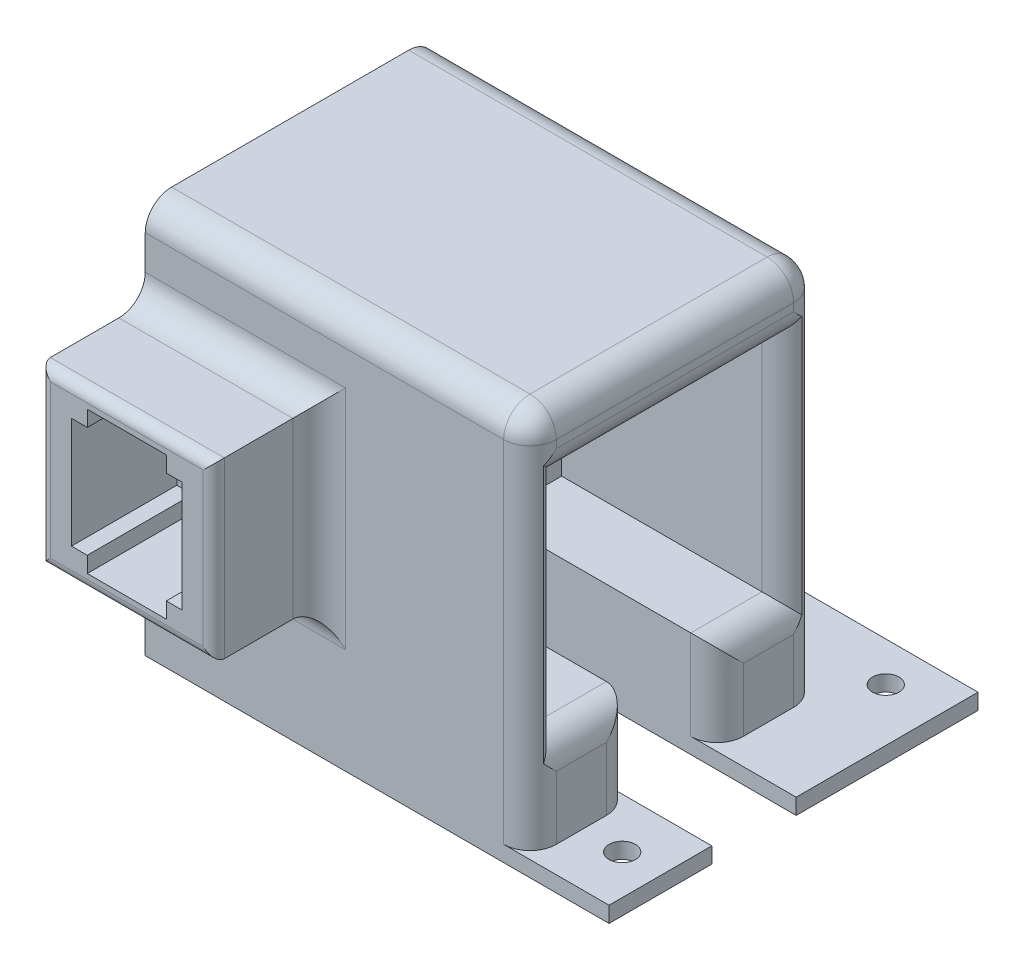
from build123d import *

# Parameters (mm, degrees)
SKETCH1_W           = 33
SKETCH1_H           = 33
BOSS_EXTRUDE1_DEPTH = 20
SHELL1_T            = -6
SKETCH2_W           = 73
SKETCH2_H           = 71.5
BOSS_EXTRUDE2_DEPTH = 55
SKETCH7_W           = 15
SKETCH7_H           = 50
CUT_EXTRUDE2_DEPTH  = 3
SKETCH9_W           = 21
SKETCH9_H           = 21
CUT_EXTRUDE5_DEPTH  = 45
SKETCH16_W          = 55
SKETCH16_H          = 55
BOSS_EXTRUDE5_DEPTH = 40
CUT_EXTRUDE14_REACH = 105.943
BOSS_EXTRUDE6_START = -26
SKETCH23_W          = 3
SKETCH23_H          = 3
BOSS_EXTRUDE6_DEPTH = 6
BOSS_EXTRUDE7_REACH = 148.943
BOSS_EXTRUDE7_START = -43
SKETCH24_W          = 13.5
SKETCH24_H          = 5
SKETCH25_R          = 2.5
BOSS_EXTRUDE8_DEPTH = 3
FILLET1_R           = 5
FILLET2_R           = 2


with BuildPart() as part:
    # Sketch1 → Boss-Extrude1 (new body)
    with BuildSketch(Plane.XY):
        with Locations((16.5, 16.5)):
            Rectangle(SKETCH1_W, SKETCH1_H)
    extrude(amount=BOSS_EXTRUDE1_DEPTH)

    # Shell1
    shell1_openings = [part.faces().sort_by_distance(p)[0] for p in [
        (16.5, 16.5, 20),
    ]]
    offset(amount=SHELL1_T, openings=shell1_openings, kind=Kind.INTERSECTION)

    # Sketch2 → Boss-Extrude2 (add)
    with BuildSketch(Plane(origin=(0, 0, 0), x_dir=(-1, 0, 0), z_dir=(0, 0, -1))):
        with Locations((-36.5, 13.75)):
            Rectangle(SKETCH2_W, SKETCH2_H)
    extrude(amount=BOSS_EXTRUDE2_DEPTH)

    # Sketch7 → Cut-Extrude2 (cut)
    with BuildSketch(Plane.XZ.offset(-27)):
        with Locations((16.5, -5)):
            Rectangle(SKETCH7_W, SKETCH7_H)
    cut_extrude2 = extrude(amount=-CUT_EXTRUDE2_DEPTH, mode=Mode.SUBTRACT)

    # Sketch9 → Cut-Extrude5 (cut)
    with BuildSketch(Plane.XY.offset(6)):
        with Locations((16.5, 16.5)):
            Rectangle(SKETCH9_W, SKETCH9_H)
    extrude(amount=-CUT_EXTRUDE5_DEPTH, mode=Mode.SUBTRACT)

    # Mirror2: Cut-Extrude2 across plane
    add(cut_extrude2.mirror(Plane(origin=(0, 16.5, 0), x_dir=(0, 0, 1), z_dir=(0, -1, 0))), mode=Mode.SUBTRACT)

    # Sketch16 → Boss-Extrude5 (add)
    with BuildSketch(Plane(origin=(33, 0, 0), x_dir=(0, 0, -1), z_dir=(1, 0, 0))):
        with Locations((27.5, 16.5)):
            Rectangle(SKETCH16_W, SKETCH16_H)
    extrude(amount=BOSS_EXTRUDE5_DEPTH)

    # Cut-Extrude14: up to this face of the body (flat: up to its plane)
    cut_extrude14_end = Plane(part.part.faces().sort_by_distance((6, 16.5, -9.5))[0])
    # Sketch22 → Cut-Extrude14 (cut, up to the picked face)
    with BuildSketch(Plane(origin=(73, 0, 0), x_dir=(0, 0, -1), z_dir=(1, 0, 0)), mode=Mode.PRIVATE) as cut_extrude14_sk1:
        Polygon((6, -5), (19.5, -5), (19.5, -22), (35.5, -22), (35.5, -5), (49, -5), (49, 38), (6, 38), align=None)
    cut_extrude14_tool1 = split(extrude(cut_extrude14_sk1.sketch, amount=-CUT_EXTRUDE14_REACH, mode=Mode.PRIVATE), bisect_by=cut_extrude14_end, keep=Keep.BOTH, mode=Mode.PRIVATE)
    add(cut_extrude14_tool1.solids().sort_by(Axis((73, 12.652758, -27.5), (-1, 0, 0)))[0], mode=Mode.SUBTRACT)

    # Sketch23 → Boss-Extrude6 (add)
    with BuildSketch(Plane.XY.offset(20).offset(BOSS_EXTRUDE6_START)):
        with Locations((7.5, 7.5)):
            Rectangle(SKETCH23_W, SKETCH23_H)
        with Locations((7.5, 25.5)):
            Rectangle(SKETCH23_W, SKETCH23_H)
        with Locations((25.5, 25.5)):
            Rectangle(SKETCH23_W, SKETCH23_H)
        with Locations((25.5, 7.5)):
            Rectangle(SKETCH23_W, SKETCH23_H)
    extrude(amount=BOSS_EXTRUDE6_DEPTH)

    # Sketch24 → Boss-Extrude7 (add, up to next)
    with BuildSketch(Plane(origin=(73, 0, 0), x_dir=(0, 0, -1), z_dir=(1, 0, 0)).offset(BOSS_EXTRUDE7_START), mode=Mode.PRIVATE) as boss_extrude7_sk1:
        with Locations((12.75, -2.5)):
            Rectangle(SKETCH24_W, SKETCH24_H)
    boss_extrude7_tool1 = extrude(boss_extrude7_sk1.sketch, amount=-BOSS_EXTRUDE7_REACH, mode=Mode.PRIVATE) - part.part
    # Sketch24 → Boss-Extrude7 (add, up to next)
    with BuildSketch(Plane(origin=(73, 0, 0), x_dir=(0, 0, -1), z_dir=(1, 0, 0)).offset(BOSS_EXTRUDE7_START), mode=Mode.PRIVATE) as boss_extrude7_sk2:
        with Locations((42.25, -2.5)):
            Rectangle(SKETCH24_W, SKETCH24_H)
    boss_extrude7_tool2 = extrude(boss_extrude7_sk2.sketch, amount=-BOSS_EXTRUDE7_REACH, mode=Mode.PRIVATE) - part.part
    add(boss_extrude7_tool1.solids().sort_by_distance((30, -2.5, -12.75))[0])
    add(boss_extrude7_tool2.solids().sort_by_distance((30, -2.5, -42.25))[0])

    # Sketch25 → Boss-Extrude8 (add)
    with BuildSketch(Plane.XZ.offset(22)):
        Polygon((0, 0), (88, 0), (88, -19.5), (30, -19.5), (30, -35.5), (88, -35.5), (88, -70), (0, -70), align=None)
        with Locations(Location((10, -62.5, 0), (0, 0, 270))):
            Circle(SKETCH25_R, mode=Mode.SUBTRACT)
        with Locations(Location((78, -62.5, 0), (0, 0, 270))):
            Circle(SKETCH25_R, mode=Mode.SUBTRACT)
        with Locations(Location((80.5, -10, 0), (0, 0, 270))):
            Circle(SKETCH25_R, mode=Mode.SUBTRACT)
    extrude(amount=BOSS_EXTRUDE8_DEPTH)

    # Fillet1
    # the kernel refuses this fillet: 5 mm, written as the material it adds along each edge
    with BuildSketch(Plane(origin=(33, 33, 0), x_dir=(0, 0, 1), z_dir=(-1, 0, 0)), Plane(origin=(33, 0, 0), x_dir=(0, 0, 1), z_dir=(0, 1, 0)), Plane(origin=(0, 0, 0), x_dir=(0, 0, 1), z_dir=(1, 0, 0))) as fillet1_piece_1:
        with BuildLine():
            CenterArc((FILLET1_R, FILLET1_R), FILLET1_R, 180, 90)
            Line((0, FILLET1_R), (-FILLET1_R * 0.02, FILLET1_R))
            Line((-FILLET1_R * 0.02, FILLET1_R), (-FILLET1_R * 0.02, -FILLET1_R * 0.02))
            Line((-FILLET1_R * 0.02, -FILLET1_R * 0.02), (FILLET1_R, -FILLET1_R * 0.02))
            Line((FILLET1_R, -FILLET1_R * 0.02), (FILLET1_R, 0))
        make_face()
    extrude(amount=33)
    with BuildSketch(Plane(origin=(33, 0, 0), x_dir=(0, 0, 1), z_dir=(0, 1, 0))) as fillet1_piece_2a_section:
        with BuildLine():
            CenterArc((FILLET1_R, FILLET1_R), FILLET1_R, 180, 90)
            Line((0, FILLET1_R), (-FILLET1_R * 0.02, FILLET1_R))
            Line((-FILLET1_R * 0.02, FILLET1_R), (-FILLET1_R * 0.02, -FILLET1_R * 0.02))
            Line((-FILLET1_R * 0.02, -FILLET1_R * 0.02), (FILLET1_R, -FILLET1_R * 0.02))
            Line((FILLET1_R, -FILLET1_R * 0.02), (FILLET1_R, 0))
        make_face()
    fillet1_piece_2a = extrude(amount=45.5, mode=Mode.PRIVATE)
    fillet1_piece_2a = split(fillet1_piece_2a, bisect_by=Plane(origin=(34.131975571, 33, 1.131975571), z_dir=(0, 1, 0)), keep=Keep.TOP, mode=Mode.PRIVATE)
    with BuildSketch(Plane(origin=(45.5, 33, 0), x_dir=(0, 0, 1), z_dir=(-1, 0, 0))) as fillet1_piece_2b_section:
        with BuildLine():
            CenterArc((FILLET1_R, FILLET1_R), FILLET1_R, 180, 90)
            Line((0, FILLET1_R), (-FILLET1_R * 0.02, FILLET1_R))
            Line((-FILLET1_R * 0.02, FILLET1_R), (-FILLET1_R * 0.02, -FILLET1_R * 0.02))
            Line((-FILLET1_R * 0.02, -FILLET1_R * 0.02), (FILLET1_R, -FILLET1_R * 0.02))
            Line((FILLET1_R, -FILLET1_R * 0.02), (FILLET1_R, 0))
        make_face()
    fillet1_piece_2b = extrude(amount=45.5, mode=Mode.PRIVATE)
    fillet1_piece_2b = split(fillet1_piece_2b, bisect_by=Plane(origin=(33, 34.131975571, 1.131975571), z_dir=(1, 0, 0)), keep=Keep.TOP, mode=Mode.PRIVATE)
    fillet1_piece_2 = fillet1_piece_2a & fillet1_piece_2b
    add(fillet1_piece_2)
    with BuildSketch(Plane(origin=(0, 0, 0), x_dir=(0, 0, 1), z_dir=(1, 0, 0))) as fillet1_piece_3a_section:
        with BuildLine():
            CenterArc((FILLET1_R, FILLET1_R), FILLET1_R, 180, 90)
            Line((0, FILLET1_R), (-FILLET1_R * 0.02, FILLET1_R))
            Line((-FILLET1_R * 0.02, FILLET1_R), (-FILLET1_R * 0.02, -FILLET1_R * 0.02))
            Line((-FILLET1_R * 0.02, -FILLET1_R * 0.02), (FILLET1_R, -FILLET1_R * 0.02))
            Line((FILLET1_R, -FILLET1_R * 0.02), (FILLET1_R, 0))
        make_face()
    fillet1_piece_3a = extrude(amount=45.5, mode=Mode.PRIVATE)
    fillet1_piece_3a = split(fillet1_piece_3a, bisect_by=Plane(origin=(33, -1.131975571, 1.131975571), z_dir=(1, 0, 0)), keep=Keep.TOP, mode=Mode.PRIVATE)
    with BuildSketch(Plane(origin=(33, -12.5, 0), x_dir=(0, 0, 1), z_dir=(0, 1, 0))) as fillet1_piece_3b_section:
        with BuildLine():
            CenterArc((FILLET1_R, FILLET1_R), FILLET1_R, 180, 90)
            Line((0, FILLET1_R), (-FILLET1_R * 0.02, FILLET1_R))
            Line((-FILLET1_R * 0.02, FILLET1_R), (-FILLET1_R * 0.02, -FILLET1_R * 0.02))
            Line((-FILLET1_R * 0.02, -FILLET1_R * 0.02), (FILLET1_R, -FILLET1_R * 0.02))
            Line((FILLET1_R, -FILLET1_R * 0.02), (FILLET1_R, 0))
        make_face()
    fillet1_piece_3b = extrude(amount=45.5, mode=Mode.PRIVATE)
    fillet1_piece_3b = split(fillet1_piece_3b, bisect_by=Plane(origin=(34.131975571, 0, 1.131975571), z_dir=(0, -1, 0)), keep=Keep.TOP, mode=Mode.PRIVATE)
    fillet1_piece_3 = fillet1_piece_3a & fillet1_piece_3b
    add(fillet1_piece_3)
    # the kernel refuses this fillet: 5 mm, written as the material it takes off along each edge
    with BuildSketch(Plane(origin=(68, 44.5, -50), x_dir=(0, 1, 0), z_dir=(1, 0, 0))) as fillet1_2_piece_1_section:
        Polygon((0, 0), (FILLET1_R * 1.02, 0), (FILLET1_R * 1.02, -FILLET1_R * 1.02), (0, -FILLET1_R * 1.02), align=None)
    fillet1_2_piece_1 = extrude(amount=FILLET1_R * 1.02, mode=Mode.PRIVATE)
    fillet1_2_piece_1 = fillet1_2_piece_1 - Plane(origin=(68, 44.5, -50), x_dir=(0, -0.7071067811865475, 0.7071067811865475), z_dir=(1, 0, 0)) * Sphere(FILLET1_R, mode=Mode.PRIVATE)
    add(fillet1_2_piece_1, mode=Mode.SUBTRACT)
    with BuildSketch(Plane(origin=(68, 44.5, -5), x_dir=(0, 1, 0), z_dir=(1, 0, 0))) as fillet1_2_piece_2_section:
        Polygon((0, 0), (FILLET1_R * 1.02, 0), (FILLET1_R * 1.02, FILLET1_R * 1.02), (0, FILLET1_R * 1.02), align=None)
    fillet1_2_piece_2 = extrude(amount=FILLET1_R * 1.02, mode=Mode.PRIVATE)
    fillet1_2_piece_2 = fillet1_2_piece_2 - Plane(origin=(68, 44.5, -5), x_dir=(0, -0.7071067811865475, -0.7071067811865475), z_dir=(1, 0, 0)) * Sphere(FILLET1_R, mode=Mode.PRIVATE)
    add(fillet1_2_piece_2, mode=Mode.SUBTRACT)
    with BuildSketch(Plane(origin=(73, -5, -49), x_dir=(0, 0, -1), z_dir=(0, 1, 0)), Plane(origin=(73, 38, -49), x_dir=(0, 1, 0), z_dir=(0, 0, 1)), Plane(origin=(73, 38, -6), x_dir=(0, 0, 1), z_dir=(0, -1, 0))) as fillet1_2_piece_3:
        with BuildLine():
            CenterArc((FILLET1_R, FILLET1_R), FILLET1_R, 180, 90)
            Line((0, FILLET1_R), (-FILLET1_R * 0.02, FILLET1_R))
            Line((-FILLET1_R * 0.02, FILLET1_R), (-FILLET1_R * 0.02, -FILLET1_R * 0.02))
            Line((-FILLET1_R * 0.02, -FILLET1_R * 0.02), (FILLET1_R, -FILLET1_R * 0.02))
            Line((FILLET1_R, -FILLET1_R * 0.02), (FILLET1_R, 0))
        make_face()
    extrude(amount=43, mode=Mode.SUBTRACT)
    with BuildSketch(Plane(origin=(73, -5, -6), x_dir=(0, -1, 0), z_dir=(0, 0, -1)), Plane(origin=(73, -5, -35.5), x_dir=(0, -1, 0), z_dir=(0, 0, -1))) as fillet1_2_piece_4:
        with BuildLine():
            CenterArc((FILLET1_R, FILLET1_R), FILLET1_R, 180, 90)
            Line((0, FILLET1_R), (-FILLET1_R * 0.02, FILLET1_R))
            Line((-FILLET1_R * 0.02, FILLET1_R), (-FILLET1_R * 0.02, -FILLET1_R * 0.02))
            Line((-FILLET1_R * 0.02, -FILLET1_R * 0.02), (FILLET1_R, -FILLET1_R * 0.02))
            Line((FILLET1_R, -FILLET1_R * 0.02), (FILLET1_R, 0))
        make_face()
    extrude(amount=13.5, mode=Mode.SUBTRACT)
    with BuildSketch(Plane(origin=(73, -5, -19.5), x_dir=(0, 0, 1), z_dir=(0, -1, 0)), Plane(origin=(73, -22, -35.5), x_dir=(0, 0, -1), z_dir=(0, 1, 0))) as fillet1_2_piece_5:
        with BuildLine():
            CenterArc((FILLET1_R, FILLET1_R), FILLET1_R, 180, 90)
            Line((0, FILLET1_R), (-FILLET1_R * 0.02, FILLET1_R))
            Line((-FILLET1_R * 0.02, FILLET1_R), (-FILLET1_R * 0.02, -FILLET1_R * 0.02))
            Line((-FILLET1_R * 0.02, -FILLET1_R * 0.02), (FILLET1_R, -FILLET1_R * 0.02))
            Line((FILLET1_R, -FILLET1_R * 0.02), (FILLET1_R, 0))
        make_face()
    extrude(amount=17, mode=Mode.SUBTRACT)
    with BuildSketch(Plane(origin=(0, 49.5, -55), x_dir=(0, 0, 1), z_dir=(1, 0, 0))) as fillet1_2_piece_6:
        with BuildLine():
            CenterArc((FILLET1_R, FILLET1_R), FILLET1_R, 180, 90)
            Line((0, FILLET1_R), (-FILLET1_R * 0.02, FILLET1_R))
            Line((-FILLET1_R * 0.02, FILLET1_R), (-FILLET1_R * 0.02, -FILLET1_R * 0.02))
            Line((-FILLET1_R * 0.02, -FILLET1_R * 0.02), (FILLET1_R, -FILLET1_R * 0.02))
            Line((FILLET1_R, -FILLET1_R * 0.02), (FILLET1_R, 0))
        make_face()
    extrude(amount=68, mode=Mode.SUBTRACT)
    with BuildSketch(Plane(origin=(73, -22, -55), x_dir=(0, 0, 1), z_dir=(0, 1, 0)), Plane(origin=(73, 44.5, 0), x_dir=(0, 0, -1), z_dir=(0, -1, 0))) as fillet1_2_piece_7:
        with BuildLine():
            CenterArc((FILLET1_R, -FILLET1_R), FILLET1_R, 90, 90)
            Line((0, -FILLET1_R), (-FILLET1_R * 0.02, -FILLET1_R))
            Line((-FILLET1_R * 0.02, -FILLET1_R), (-FILLET1_R * 0.02, FILLET1_R * 0.02))
            Line((-FILLET1_R * 0.02, FILLET1_R * 0.02), (FILLET1_R, FILLET1_R * 0.02))
            Line((FILLET1_R, FILLET1_R * 0.02), (FILLET1_R, 0))
        make_face()
    extrude(amount=66.5, mode=Mode.SUBTRACT)
    with BuildSketch(Plane(origin=(73, 49.5, -5), x_dir=(0, -1, 0), z_dir=(0, 0, -1))) as fillet1_2_piece_8:
        with BuildLine():
            CenterArc((FILLET1_R, FILLET1_R), FILLET1_R, 180, 90)
            Line((0, FILLET1_R), (-FILLET1_R * 0.02, FILLET1_R))
            Line((-FILLET1_R * 0.02, FILLET1_R), (-FILLET1_R * 0.02, -FILLET1_R * 0.02))
            Line((-FILLET1_R * 0.02, -FILLET1_R * 0.02), (FILLET1_R, -FILLET1_R * 0.02))
            Line((FILLET1_R, -FILLET1_R * 0.02), (FILLET1_R, 0))
        make_face()
    extrude(amount=45, mode=Mode.SUBTRACT)
    with BuildSketch(Plane(origin=(0, 49.5, 0), x_dir=(0, 0, -1), z_dir=(1, 0, 0))) as fillet1_2_piece_9:
        with BuildLine():
            CenterArc((FILLET1_R, -FILLET1_R), FILLET1_R, 90, 90)
            Line((0, -FILLET1_R), (-FILLET1_R * 0.02, -FILLET1_R))
            Line((-FILLET1_R * 0.02, -FILLET1_R), (-FILLET1_R * 0.02, FILLET1_R * 0.02))
            Line((-FILLET1_R * 0.02, FILLET1_R * 0.02), (FILLET1_R, FILLET1_R * 0.02))
            Line((FILLET1_R, FILLET1_R * 0.02), (FILLET1_R, 0))
        make_face()
    extrude(amount=68, mode=Mode.SUBTRACT)
    with BuildSketch(Plane(origin=(73, -17.5, -49), x_dir=(0, 0, -1), z_dir=(0, 1, 0))) as fillet1_2_piece_10a_section:
        with BuildLine():
            CenterArc((FILLET1_R, FILLET1_R), FILLET1_R, 180, 90)
            Line((0, FILLET1_R), (-FILLET1_R * 0.02, FILLET1_R))
            Line((-FILLET1_R * 0.02, FILLET1_R), (-FILLET1_R * 0.02, -FILLET1_R * 0.02))
            Line((-FILLET1_R * 0.02, -FILLET1_R * 0.02), (FILLET1_R, -FILLET1_R * 0.02))
            Line((FILLET1_R, -FILLET1_R * 0.02), (FILLET1_R, 0))
        make_face()
    fillet1_2_piece_10a = extrude(amount=55.5, mode=Mode.PRIVATE)
    fillet1_2_piece_10a = split(fillet1_2_piece_10a, bisect_by=Plane(origin=(71.868024429, -5, -50.131975571), z_dir=(0, -1, 0)), keep=Keep.TOP, mode=Mode.PRIVATE)
    with BuildSketch(Plane(origin=(73, -5, -35.5), x_dir=(0, -1, 0), z_dir=(0, 0, -1))) as fillet1_2_piece_10b_section:
        with BuildLine():
            CenterArc((FILLET1_R, FILLET1_R), FILLET1_R, 180, 90)
            Line((0, FILLET1_R), (-FILLET1_R * 0.02, FILLET1_R))
            Line((-FILLET1_R * 0.02, FILLET1_R), (-FILLET1_R * 0.02, -FILLET1_R * 0.02))
            Line((-FILLET1_R * 0.02, -FILLET1_R * 0.02), (FILLET1_R, -FILLET1_R * 0.02))
            Line((FILLET1_R, -FILLET1_R * 0.02), (FILLET1_R, 0))
        make_face()
    fillet1_2_piece_10b = extrude(amount=26, mode=Mode.PRIVATE)
    fillet1_2_piece_10b = split(fillet1_2_piece_10b, bisect_by=Plane(origin=(71.868024429, -6.131975571, -49), z_dir=(0, 0, -1)), keep=Keep.TOP, mode=Mode.PRIVATE)
    fillet1_2_piece_10 = fillet1_2_piece_10a & fillet1_2_piece_10b
    add(fillet1_2_piece_10, mode=Mode.SUBTRACT)
    with BuildSketch(Plane(origin=(73, 38, -61.5), x_dir=(0, 1, 0), z_dir=(0, 0, 1))) as fillet1_2_piece_11a_section:
        with BuildLine():
            CenterArc((FILLET1_R, FILLET1_R), FILLET1_R, 180, 90)
            Line((0, FILLET1_R), (-FILLET1_R * 0.02, FILLET1_R))
            Line((-FILLET1_R * 0.02, FILLET1_R), (-FILLET1_R * 0.02, -FILLET1_R * 0.02))
            Line((-FILLET1_R * 0.02, -FILLET1_R * 0.02), (FILLET1_R, -FILLET1_R * 0.02))
            Line((FILLET1_R, -FILLET1_R * 0.02), (FILLET1_R, 0))
        make_face()
    fillet1_2_piece_11a = extrude(amount=55.5, mode=Mode.PRIVATE)
    fillet1_2_piece_11a = split(fillet1_2_piece_11a, bisect_by=Plane(origin=(71.868024429, 39.131975571, -49), z_dir=(0, 0, -1)), keep=Keep.TOP, mode=Mode.PRIVATE)
    with BuildSketch(Plane(origin=(73, -5, -49), x_dir=(0, 0, -1), z_dir=(0, 1, 0))) as fillet1_2_piece_11b_section:
        with BuildLine():
            CenterArc((FILLET1_R, FILLET1_R), FILLET1_R, 180, 90)
            Line((0, FILLET1_R), (-FILLET1_R * 0.02, FILLET1_R))
            Line((-FILLET1_R * 0.02, FILLET1_R), (-FILLET1_R * 0.02, -FILLET1_R * 0.02))
            Line((-FILLET1_R * 0.02, -FILLET1_R * 0.02), (FILLET1_R, -FILLET1_R * 0.02))
            Line((FILLET1_R, -FILLET1_R * 0.02), (FILLET1_R, 0))
        make_face()
    fillet1_2_piece_11b = extrude(amount=55.5, mode=Mode.PRIVATE)
    fillet1_2_piece_11b = split(fillet1_2_piece_11b, bisect_by=Plane(origin=(71.868024429, 38, -50.131975571), z_dir=(0, 1, 0)), keep=Keep.TOP, mode=Mode.PRIVATE)
    fillet1_2_piece_11 = fillet1_2_piece_11a & fillet1_2_piece_11b
    add(fillet1_2_piece_11, mode=Mode.SUBTRACT)
    with BuildSketch(Plane(origin=(73, 50.5, -6), x_dir=(0, 0, 1), z_dir=(0, -1, 0))) as fillet1_2_piece_12a_section:
        with BuildLine():
            CenterArc((FILLET1_R, FILLET1_R), FILLET1_R, 180, 90)
            Line((0, FILLET1_R), (-FILLET1_R * 0.02, FILLET1_R))
            Line((-FILLET1_R * 0.02, FILLET1_R), (-FILLET1_R * 0.02, -FILLET1_R * 0.02))
            Line((-FILLET1_R * 0.02, -FILLET1_R * 0.02), (FILLET1_R, -FILLET1_R * 0.02))
            Line((FILLET1_R, -FILLET1_R * 0.02), (FILLET1_R, 0))
        make_face()
    fillet1_2_piece_12a = extrude(amount=55.5, mode=Mode.PRIVATE)
    fillet1_2_piece_12a = split(fillet1_2_piece_12a, bisect_by=Plane(origin=(71.868024429, 38, -4.868024429), z_dir=(0, 1, 0)), keep=Keep.TOP, mode=Mode.PRIVATE)
    with BuildSketch(Plane(origin=(73, 38, -49), x_dir=(0, 1, 0), z_dir=(0, 0, 1))) as fillet1_2_piece_12b_section:
        with BuildLine():
            CenterArc((FILLET1_R, FILLET1_R), FILLET1_R, 180, 90)
            Line((0, FILLET1_R), (-FILLET1_R * 0.02, FILLET1_R))
            Line((-FILLET1_R * 0.02, FILLET1_R), (-FILLET1_R * 0.02, -FILLET1_R * 0.02))
            Line((-FILLET1_R * 0.02, -FILLET1_R * 0.02), (FILLET1_R, -FILLET1_R * 0.02))
            Line((FILLET1_R, -FILLET1_R * 0.02), (FILLET1_R, 0))
        make_face()
    fillet1_2_piece_12b = extrude(amount=55.5, mode=Mode.PRIVATE)
    fillet1_2_piece_12b = split(fillet1_2_piece_12b, bisect_by=Plane(origin=(71.868024429, 39.131975571, -6), z_dir=(0, 0, 1)), keep=Keep.TOP, mode=Mode.PRIVATE)
    fillet1_2_piece_12 = fillet1_2_piece_12a & fillet1_2_piece_12b
    add(fillet1_2_piece_12, mode=Mode.SUBTRACT)
    with BuildSketch(Plane(origin=(73, -5, 6.5), x_dir=(0, -1, 0), z_dir=(0, 0, -1))) as fillet1_2_piece_13a_section:
        with BuildLine():
            CenterArc((FILLET1_R, FILLET1_R), FILLET1_R, 180, 90)
            Line((0, FILLET1_R), (-FILLET1_R * 0.02, FILLET1_R))
            Line((-FILLET1_R * 0.02, FILLET1_R), (-FILLET1_R * 0.02, -FILLET1_R * 0.02))
            Line((-FILLET1_R * 0.02, -FILLET1_R * 0.02), (FILLET1_R, -FILLET1_R * 0.02))
            Line((FILLET1_R, -FILLET1_R * 0.02), (FILLET1_R, 0))
        make_face()
    fillet1_2_piece_13a = extrude(amount=26, mode=Mode.PRIVATE)
    fillet1_2_piece_13a = split(fillet1_2_piece_13a, bisect_by=Plane(origin=(71.868024429, -6.131975571, -6), z_dir=(0, 0, 1)), keep=Keep.TOP, mode=Mode.PRIVATE)
    with BuildSketch(Plane(origin=(73, 38, -6), x_dir=(0, 0, 1), z_dir=(0, -1, 0))) as fillet1_2_piece_13b_section:
        with BuildLine():
            CenterArc((FILLET1_R, FILLET1_R), FILLET1_R, 180, 90)
            Line((0, FILLET1_R), (-FILLET1_R * 0.02, FILLET1_R))
            Line((-FILLET1_R * 0.02, FILLET1_R), (-FILLET1_R * 0.02, -FILLET1_R * 0.02))
            Line((-FILLET1_R * 0.02, -FILLET1_R * 0.02), (FILLET1_R, -FILLET1_R * 0.02))
            Line((FILLET1_R, -FILLET1_R * 0.02), (FILLET1_R, 0))
        make_face()
    fillet1_2_piece_13b = extrude(amount=55.5, mode=Mode.PRIVATE)
    fillet1_2_piece_13b = split(fillet1_2_piece_13b, bisect_by=Plane(origin=(71.868024429, -5, -4.868024429), z_dir=(0, -1, 0)), keep=Keep.TOP, mode=Mode.PRIVATE)
    fillet1_2_piece_13 = fillet1_2_piece_13a & fillet1_2_piece_13b
    add(fillet1_2_piece_13, mode=Mode.SUBTRACT)
    with BuildSketch(Plane(origin=(73, 7.5, -19.5), x_dir=(0, 0, 1), z_dir=(0, -1, 0))) as fillet1_2_piece_14a_section:
        with BuildLine():
            CenterArc((FILLET1_R, FILLET1_R), FILLET1_R, 180, 90)
            Line((0, FILLET1_R), (-FILLET1_R * 0.02, FILLET1_R))
            Line((-FILLET1_R * 0.02, FILLET1_R), (-FILLET1_R * 0.02, -FILLET1_R * 0.02))
            Line((-FILLET1_R * 0.02, -FILLET1_R * 0.02), (FILLET1_R, -FILLET1_R * 0.02))
            Line((FILLET1_R, -FILLET1_R * 0.02), (FILLET1_R, 0))
        make_face()
    fillet1_2_piece_14a = extrude(amount=29.5, mode=Mode.PRIVATE)
    fillet1_2_piece_14a = split(fillet1_2_piece_14a, bisect_by=Plane(origin=(71.868024429, -5, -18.368024429), z_dir=(0, 1, 0)), keep=Keep.TOP, mode=Mode.PRIVATE)
    with BuildSketch(Plane(origin=(73, -5, -6), x_dir=(0, -1, 0), z_dir=(0, 0, -1))) as fillet1_2_piece_14b_section:
        with BuildLine():
            CenterArc((FILLET1_R, FILLET1_R), FILLET1_R, 180, 90)
            Line((0, FILLET1_R), (-FILLET1_R * 0.02, FILLET1_R))
            Line((-FILLET1_R * 0.02, FILLET1_R), (-FILLET1_R * 0.02, -FILLET1_R * 0.02))
            Line((-FILLET1_R * 0.02, -FILLET1_R * 0.02), (FILLET1_R, -FILLET1_R * 0.02))
            Line((FILLET1_R, -FILLET1_R * 0.02), (FILLET1_R, 0))
        make_face()
    fillet1_2_piece_14b = extrude(amount=26, mode=Mode.PRIVATE)
    fillet1_2_piece_14b = split(fillet1_2_piece_14b, bisect_by=Plane(origin=(71.868024429, -6.131975571, -19.5), z_dir=(0, 0, -1)), keep=Keep.TOP, mode=Mode.PRIVATE)
    fillet1_2_piece_14 = fillet1_2_piece_14a & fillet1_2_piece_14b
    add(fillet1_2_piece_14, mode=Mode.SUBTRACT)
    with BuildSketch(Plane(origin=(73, -5, -23), x_dir=(0, -1, 0), z_dir=(0, 0, -1))) as fillet1_2_piece_15a_section:
        with BuildLine():
            CenterArc((FILLET1_R, FILLET1_R), FILLET1_R, 180, 90)
            Line((0, FILLET1_R), (-FILLET1_R * 0.02, FILLET1_R))
            Line((-FILLET1_R * 0.02, FILLET1_R), (-FILLET1_R * 0.02, -FILLET1_R * 0.02))
            Line((-FILLET1_R * 0.02, -FILLET1_R * 0.02), (FILLET1_R, -FILLET1_R * 0.02))
            Line((FILLET1_R, -FILLET1_R * 0.02), (FILLET1_R, 0))
        make_face()
    fillet1_2_piece_15a = extrude(amount=26, mode=Mode.PRIVATE)
    fillet1_2_piece_15a = split(fillet1_2_piece_15a, bisect_by=Plane(origin=(71.868024429, -6.131975571, -35.5), z_dir=(0, 0, 1)), keep=Keep.TOP, mode=Mode.PRIVATE)
    with BuildSketch(Plane(origin=(73, -22, -35.5), x_dir=(0, 0, -1), z_dir=(0, 1, 0))) as fillet1_2_piece_15b_section:
        with BuildLine():
            CenterArc((FILLET1_R, FILLET1_R), FILLET1_R, 180, 90)
            Line((0, FILLET1_R), (-FILLET1_R * 0.02, FILLET1_R))
            Line((-FILLET1_R * 0.02, FILLET1_R), (-FILLET1_R * 0.02, -FILLET1_R * 0.02))
            Line((-FILLET1_R * 0.02, -FILLET1_R * 0.02), (FILLET1_R, -FILLET1_R * 0.02))
            Line((FILLET1_R, -FILLET1_R * 0.02), (FILLET1_R, 0))
        make_face()
    fillet1_2_piece_15b = extrude(amount=29.5, mode=Mode.PRIVATE)
    fillet1_2_piece_15b = split(fillet1_2_piece_15b, bisect_by=Plane(origin=(71.868024429, -5, -36.631975571), z_dir=(0, 1, 0)), keep=Keep.TOP, mode=Mode.PRIVATE)
    fillet1_2_piece_15 = fillet1_2_piece_15a & fillet1_2_piece_15b
    add(fillet1_2_piece_15, mode=Mode.SUBTRACT)

    # Fillet2
    fillet2_edges = [part.edges().sort_by_distance(p)[0] for p in [
        (33, 16.5, 20),
        (16.5, 33, 20),
        (0, 16.5, 20),
        (16.5, 0, 20),
    ]]
    fillet(fillet2_edges, radius=FILLET2_R)


solid = part.part
